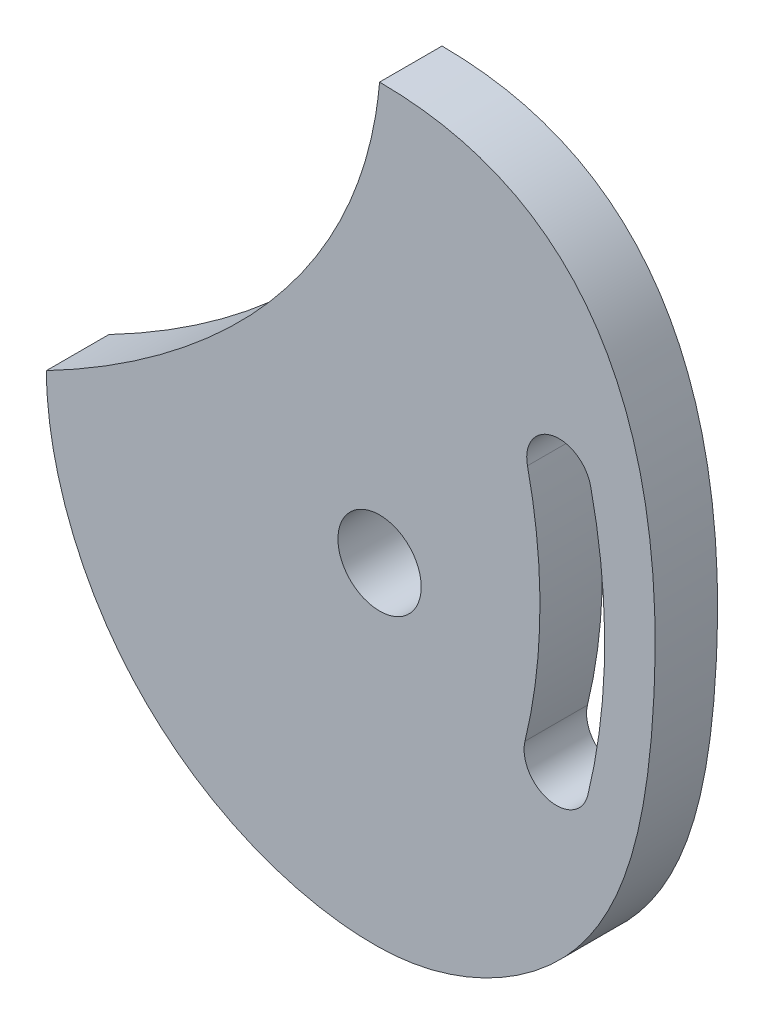
from build123d import *

# Parameters (mm, degrees)
BOSS_EXTRUDE2_DEPTH = 19.05
SKETCH3_R           = 12.7
CUT_EXTRUDE1_DEPTH  = 19.05
CUT_EXTRUDE2_DEPTH  = 19.05


with BuildPart() as part:
    # Sketch2 → Boss-Extrude2 (new body)
    with BuildSketch(Plane.XY):
        with BuildLine():
            add(Edge.make_bspline(
                [(0, 127), (75.323415785, 126.778319322), (93.522795402, 28.650558453), (71.266080599, -74.324004607), (20.401387298, -101.839799441), (-31.306066166, -101.605358228), (-84.125978149, -73.35015158), (-101.570888139, -21.992438162), (-101.6, 0)],
                knots=[0, 0, 0, 0, 0.362446511, 0.534242942, 0.652639458, 0.684562131, 0.853469674, 1, 1, 1, 1], degree=3))
            add(Edge.make_bspline(
                [(-101.6, 0), (-52.903402575, 25.232404595), (-5.0651756, 68.873831516), (0, 127)],
                knots=[0, 0, 0, 0, 1, 1, 1, 1], degree=3))
        make_face()
    extrude(amount=BOSS_EXTRUDE2_DEPTH)

    # Sketch3 → Cut-Extrude1 (cut)
    with BuildSketch(Plane.XY.offset(19.05)):
        Circle(SKETCH3_R)
    extrude(amount=-CUT_EXTRUDE1_DEPTH, mode=Mode.SUBTRACT)

    # Sketch5 → Cut-Extrude2 (cut)
    with BuildSketch(Plane.XY.offset(19.05)):
        with BuildLine():
            ThreePointArc((63.517850971, -29.551607831), (68.633094948, 11.409954025), (64.366367287, 52.468574382))
            ThreePointArc((64.366367287, 52.468574382), (52.607047724, 59.972140199), (45.103481907, 48.212820636))
            ThreePointArc((45.103481907, 48.212820636), (48.906753492, 11.614027244), (44.347132252, -24.898250235))
            ThreePointArc((44.347132252, -24.898250235), (51.605812813, -36.810288392), (63.517850971, -29.551607831))
        make_face()
    extrude(amount=-CUT_EXTRUDE2_DEPTH, mode=Mode.SUBTRACT)


solid = part.part
